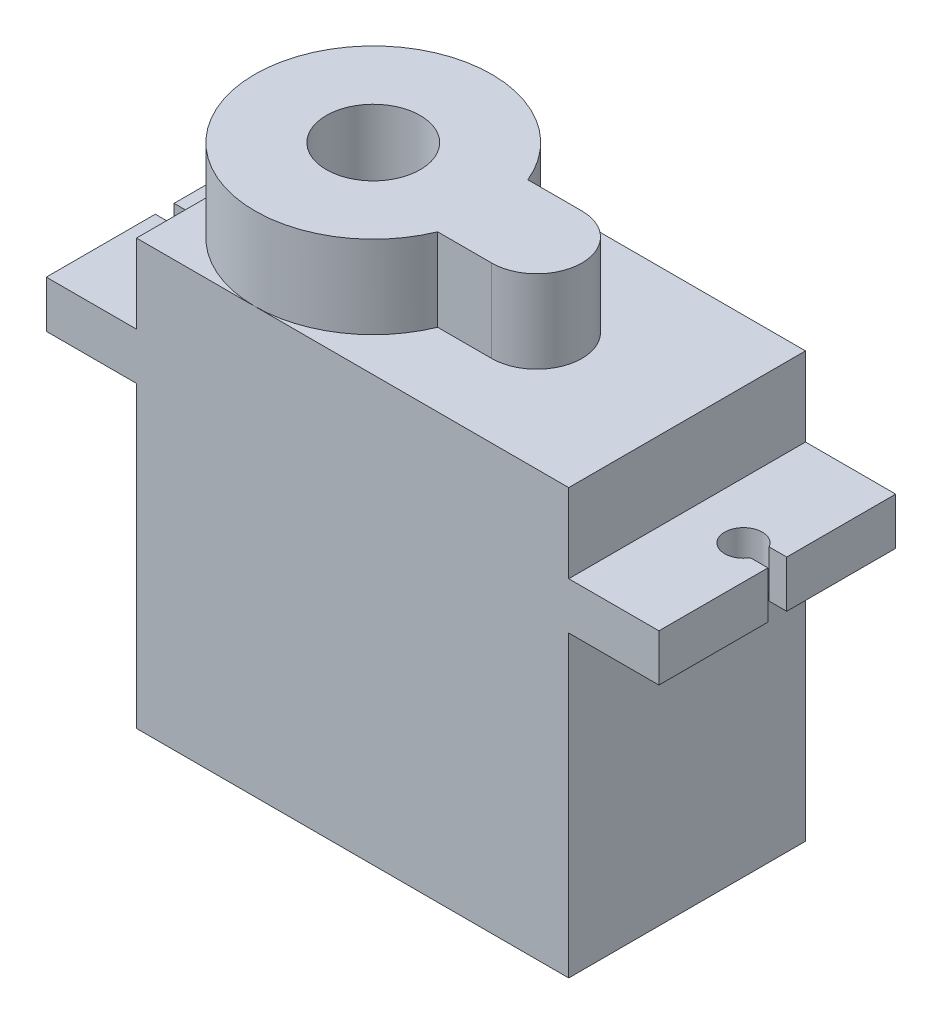
from build123d import *

# Parameters (mm, degrees)
SALIENTE_EXTRUIR1_DEPTH = 12.6
CORTAR_EXTRUIR2_DEPTH   = 2.5
CROQUIS4_R              = 2.5
SALIENTE_EXTRUIR4_DEPTH = 4.4


with BuildPart() as part:
    # Croquis1 → Saliente-Extruir1 (new body)
    with BuildSketch(Plane.XY):
        Polygon((11.5, 0), (-11.5, 0), (-11.5, 15.9), (-16.3, 15.9), (-16.3, 18.4), (-11.5, 18.4), (-11.5, 22.6), (11.5, 22.6), (11.5, 18.4), (16.3, 18.4), (16.3, 15.9), (11.5, 15.9), align=None)
    extrude(amount=SALIENTE_EXTRUIR1_DEPTH)

    # Croquis2 → Cortar-Extruir2 (cut)
    with BuildSketch(Plane(origin=(0, 18.4, 0), x_dir=(1, 0, 0), z_dir=(0, 1, 0))):
        with BuildLine():
            Line((-16.3, -5.8), (-16.3, -6.8))
            Line((-16.3, -6.8), (-15.366025404, -6.8))
            ThreePointArc((-15.366025404, -6.8), (-13.5, -6.3), (-15.366025404, -5.8))
            Line((-15.366025404, -5.8), (-16.3, -5.8))
        make_face()
        with BuildLine():
            Line((16.3, -5.8), (15.366025404, -5.8))
            ThreePointArc((15.366025404, -5.8), (13.5, -6.3), (15.366025404, -6.8))
            Line((15.366025404, -6.8), (16.3, -6.8))
            Line((16.3, -6.8), (16.3, -5.8))
        make_face()
    extrude(amount=-CORTAR_EXTRUIR2_DEPTH, mode=Mode.SUBTRACT)

    # Croquis4 → Saliente-Extruir4 (add)
    with BuildSketch(Plane(origin=(0, 22.6, 0), x_dir=(1, 0, 0), z_dir=(0, 1, 0))):
        with BuildLine():
            ThreePointArc((0.624946352, -3.9), (-11.5, -6.3), (0.624946352, -8.7))
            Line((0.624946352, -8.7), (3.5, -8.7))
            ThreePointArc((3.5, -8.7), (5.9, -6.3), (3.5, -3.9))
            Line((3.5, -3.9), (0.624946352, -3.9))
        make_face()
        with Locations((-5.2, -6.3)):
            Circle(CROQUIS4_R, mode=Mode.SUBTRACT)
    extrude(amount=SALIENTE_EXTRUIR4_DEPTH)


solid = part.part
